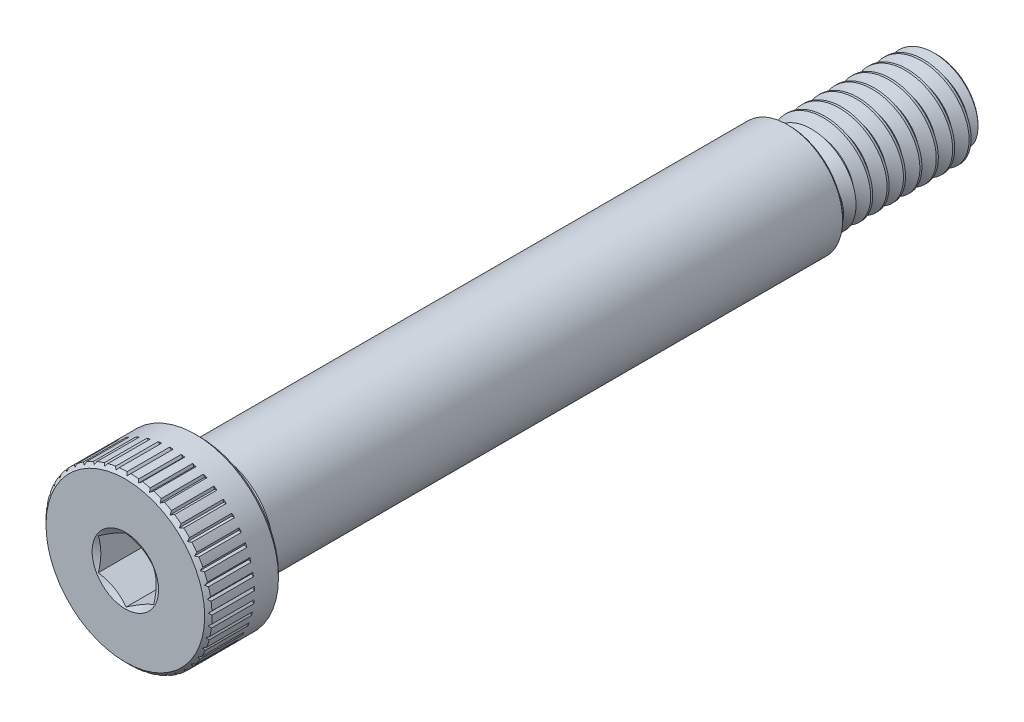
from build123d import *

# Parameters (mm, degrees)
CUT_EXTRUDE1_DEPTH = 3.96875
CUT_SWEEP2_PITCH   = 1.411111111
CUT_EXTRUDE4_START = 53.18125
CUT_EXTRUDE4_DEPTH = 5.854849353
CIRPATTERN1_COUNT  = 45


# Read off the part's stored shape, not the designer's step: DeleteFace3
with BuildPart() as part:
    # Sketch2 → Revolve2 (revolve)
    with BuildSketch(Plane(origin=(0, 0, 0), x_dir=(0, 0, -1), z_dir=(1, 0, 0)), mode=Mode.PRIVATE) as revolve2_sk:
        with BuildLine():
            Line((-57.15, 0), (-57.15, 6.82625))
            Line((-57.15, 6.82625), (-56.8325, 7.14375))
            Line((-56.8325, 7.14375), (-51.1175, 7.14375))
            Line((-51.1175, 7.14375), (-50.8, 6.82625))
            Line((-50.8, 6.82625), (-50.8, 4.7625))
            Line((-50.8, 4.7625), (-50.683786934, 4.328786934))
            Line((-50.683786934, 4.328786934), (-49.449064712, 4.328786934))
            Line((-49.449064712, 4.328786934), (-49.198660357, 4.7625))
            Line((-49.198660357, 4.7625), (-0.19685, 4.7625))
            Line((-0.19685, 4.7625), (0, 4.56565))
            Line((0, 4.56565), (0, 3.159405085))
            ThreePointArc((0, 3.159405085), (0.051908665, 3.034086483), (0.177227267, 2.982177818))
            Line((0.177227267, 2.982177818), (0.882782822, 2.982177818))
            Line((0.882782822, 2.982177818), (1.34579004, 3.9751))
            Line((1.34579004, 3.9751), (11.994444444, 3.9751))
            Line((11.994444444, 3.9751), (12.7, 3.269544444))
            Line((12.7, 3.269544444), (12.7, 0))
            Line((12.7, 0), (-57.15, 0))
        make_face()
    revolve(revolve2_sk.sketch.rotate(Axis((0, 0, 57.15), (0, 0, -1)), 90), axis=Axis((0, 0, 57.15), (0, 0, -1)))

    # Sketch3 → Cut-Extrude1 (cut)
    with BuildSketch(Plane.XY.offset(57.15)):
        Polygon((2.38125, 1.374815329), (0, 2.749630657), (-2.38125, 1.374815329), (-2.38125, -1.374815329), (0, -2.749630657), (2.38125, -1.374815329), align=None)
    extrude(amount=-CUT_EXTRUDE1_DEPTH, mode=Mode.SUBTRACT)

    # Cut-Extrude2 cone 1 section (through the dimple's axis) → Cut-Extrude2 (revolve, cut)
    with BuildSketch(Plane(origin=(0, 0, 57.15), x_dir=(0, -1, 0), z_dir=(1, 0, 0))):
        Polygon((0, 0), (2.8575, 0), (0, 1.649778394), align=None)
    revolve(axis=Axis((0, 0, 57.15), (0, 0, -1)), mode=Mode.SUBTRACT)

    # Cut-Extrude3 cone 1 section (through the dimple's axis) → Cut-Extrude3 (revolve, cut)
    with BuildSketch(Plane(origin=(0, 0, 53.18125), x_dir=(0, -1, 0), z_dir=(1, 0, 0))):
        Polygon((0, 0), (2.38125, 0), (0, 0.20833238), align=None)
    revolve(axis=Axis((0, 0, 53.18125), (0, 0, -1)), mode=Mode.SUBTRACT)


with BuildPart() as body_2:
    # Split1: the piece on the far side of the plane
    add(part.part)
    split(bisect_by=Plane.XY, keep=Keep.BOTTOM)

    # DeleteFace3 outline → DeleteFace3 (revolve)
    with BuildSketch(Plane.XZ):
        with BuildLine():
            Line((2.982177818, -0.882782822), (3.9751, -1.34579004))
            Line((3.9751, -1.34579004), (3.9751, 0))
            Line((3.9751, 0), (3.159405085, 0))
            ThreePointArc((3.159405085, 0), (3.034086483, -0.051908665), (2.982177818, -0.177227267))
            Line((2.982177818, -0.177227267), (2.982177818, -0.882782822))
        make_face()
        Polygon((3.9751, -12.7), (3.9751, -11.994444444), (3.269544444, -12.7), align=None)
    revolve(axis=Axis((0, 0, 0), (0, 0, 1)))

    # Cut-Sweep2: the profile of Sketch8 screwed along a right-hand helix of 10 turns, 8 arcs to a turn; built about Z, then put on its axis
    cut_sweep2_z = Axis((0, 0, 0), (0, 0, 1))
    cut_sweep2_corners = [(3.058556448, 0, -0.529166667), (3.058556448, 0, -0.705555556), (4.051478629, 0, -1.278819444), (4.051478629, 0, 0.044097222)]
    with BuildLine(mode=Mode.PRIVATE) as cut_sweep2_profile:
        Line(cut_sweep2_corners[0], cut_sweep2_corners[1])
        Line(cut_sweep2_corners[1], cut_sweep2_corners[2])
        Line(cut_sweep2_corners[2], cut_sweep2_corners[3])
        Line(cut_sweep2_corners[3], cut_sweep2_corners[0])
    cut_sweep2_cap = Face(cut_sweep2_profile.wire())
    cut_sweep2_turn_angles = [0, 22.5, 45, 67.5, 90, 112.5, 135, 157.5, 180, 202.5, 225, 247.5, 270, 292.5, 315, 337.5, 360]
    cut_sweep2_turn_weights = [1, 0.9238795325112867, 1, 0.9238795325112867, 1, 0.9238795325112867, 1, 0.9238795325112867, 1, 0.9238795325112867, 1, 0.9238795325112867, 1, 0.9238795325112867, 1, 0.9238795325112867, 1]
    cut_sweep2_turn_rails = [Edge.make_bspline([Vector(p[0], p[1], 0).rotate(cut_sweep2_z, cut_sweep2_turn_angles[k]) / cut_sweep2_turn_weights[k] + Vector(0, 0, p[2] + CUT_SWEEP2_PITCH * cut_sweep2_turn_angles[k] / 360) for k in range(17)], [0, 0, 0, 1, 1, 2, 2, 3, 3, 4, 4, 5, 5, 6, 6, 7, 7, 8, 8, 8], 2, cut_sweep2_turn_weights) for p in cut_sweep2_corners]
    cut_sweep2_turn_sides = [Face.make_surface_from_curves(cut_sweep2_turn_rails[p[0]], cut_sweep2_turn_rails[p[1]]) for p in [(0, 1), (1, 2), (2, 3), (3, 0)]]
    cut_sweep2 = Plane(origin=(0, 0, -12.7), x_dir=(0, 1, 0), z_dir=(0, 0, 1)) * Solid(Shell([*[p.moved(Location((0, 0, CUT_SWEEP2_PITCH * i))) for i in range(10) for p in cut_sweep2_turn_sides], cut_sweep2_cap, cut_sweep2_cap.rotate(cut_sweep2_z, 3600).moved(Location((0, 0, CUT_SWEEP2_PITCH * 3600 / 360)))]))
    add(cut_sweep2, mode=Mode.SUBTRACT)

    # Sketch9 → Cut-Revolve3 (revolve, cut)
    with BuildSketch(Plane(origin=(0, 0, 0), x_dir=(0, 0, -1), z_dir=(1, 0, 0)), mode=Mode.PRIVATE) as cut_revolve3_sk:
        Polygon((11.454328224, 4.7625), (12.7, 3.516828224), (12.7, 4.7625), align=None)
        with BuildLine():
            Line((0, 4.7625), (0, 3.159405085))
            ThreePointArc((0, 3.159405085), (0.051908665, 3.034086483), (0.177227267, 2.982177818))
            Line((0.177227267, 2.982177818), (0.882782822, 2.982177818))
            Line((0.882782822, 2.982177818), (2.663105004, 4.7625))
            Line((2.663105004, 4.7625), (0, 4.7625))
        make_face()
    revolve(cut_revolve3_sk.sketch.rotate(Axis((0, 0, 57.15), (0, 0, -1)), 90), axis=Axis((0, 0, 57.15), (0, 0, -1)), mode=Mode.SUBTRACT)


with BuildPart() as part_1:
    add(part.part)

    # Split1
    split(bisect_by=Plane.XY, keep=Keep.TOP)

    # Combine1: union body 2
    add(body_2.part)

    # Sketch10 → Cut-Extrude4 (cut, through all)
    with BuildSketch(Plane.XY.offset(CUT_EXTRUDE4_START)):
        Polygon((-0.15875, 7.14375), (0, 6.985), (0.15875, 7.14375), align=None)
    cut_extrude4 = extrude(amount=CUT_EXTRUDE4_DEPTH, mode=Mode.SUBTRACT)

    # CirPattern1: Cut-Extrude4 ×45 about axis
    cirpattern1_axis = Axis((0, 0, 0), (0, 0, 1))
    for i in range(1, CIRPATTERN1_COUNT):
        add(cut_extrude4.rotate(cirpattern1_axis, i * 360 / CIRPATTERN1_COUNT), mode=Mode.SUBTRACT)


solid = part_1.part
